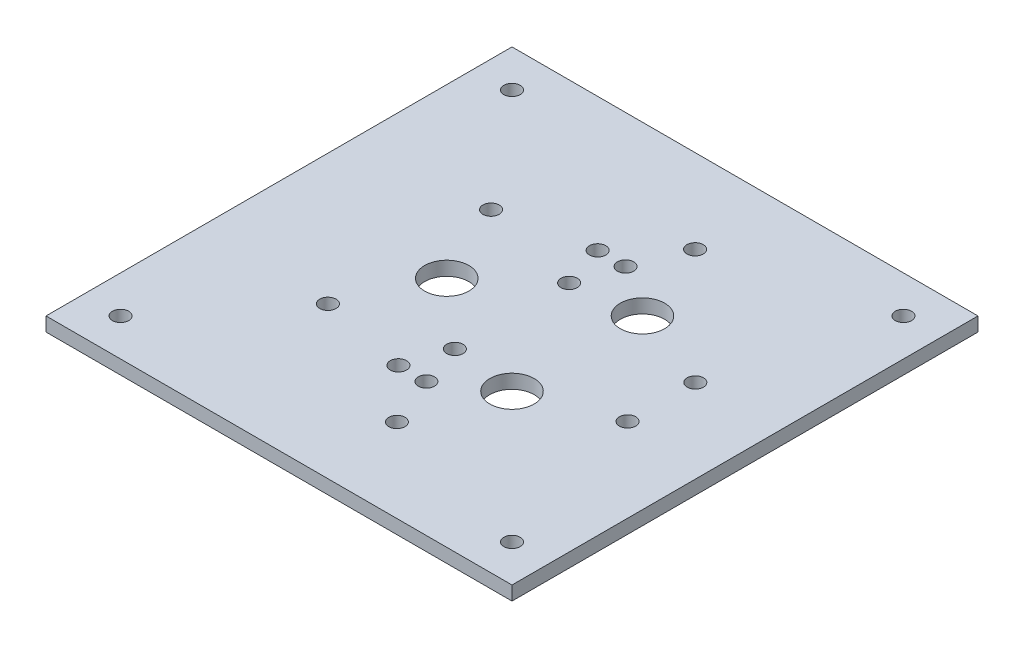
from build123d import *

# Parameters (mm, degrees)
SKETCH_2_W          = 100
SKETCH_2_H          = 100
EXTRUDE_1_DEPTH     = 3
SKETCH_3_R          = 1.75
CUT_EXTRUDE_1_DEPTH = 97.093704268
SKETCH_8_R          = 4.75
CUT_EXTRUDE_3_DEPTH = 97.093704268
SKETCH_9_R          = 1.75
CUT_EXTRUDE_4_DEPTH = 97.093704268
SKETCH_10_R         = 1.75
CUT_EXTRUDE_5_DEPTH = 10


with BuildPart() as part:
    # 草图2 → 凸台-拉伸1 (new body)
    with BuildSketch(Plane(origin=(0, 0, 0), x_dir=(1, 0, 0), z_dir=(0, 1, 0))):
        with Locations((10, 25)):
            Rectangle(SKETCH_2_W, SKETCH_2_H)
    extrude(amount=EXTRUDE_1_DEPTH)

    # 草图3 → 切除-拉伸1 (cut, through all)
    with BuildSketch(Plane(origin=(0, 3, 0), x_dir=(1, 0, 0), z_dir=(0, 1, 0))):
        with Locations((13, 3.627483327)):
            Circle(SKETCH_3_R)
        with Locations((7, 3.627483327)):
            Circle(SKETCH_3_R)
        with Locations((10, 12.735486929)):
            Circle(SKETCH_3_R)
        with Locations((13, 46.372516673)):
            Circle(SKETCH_3_R)
        with Locations((7, 46.372516673)):
            Circle(SKETCH_3_R)
        with Locations((10, 37.264513071)):
            Circle(SKETCH_3_R)
    extrude(amount=-CUT_EXTRUDE_1_DEPTH, mode=Mode.SUBTRACT)

    # 草图8 → 切除-拉伸3 (cut, through all)
    with BuildSketch(Plane.XZ):
        with Locations((-4, -25)):
            Circle(SKETCH_8_R)
        with Locations((24, -11)):
            Circle(SKETCH_8_R)
        with Locations((24, -39)):
            Circle(SKETCH_8_R)
    extrude(amount=-CUT_EXTRUDE_3_DEPTH, mode=Mode.SUBTRACT)

    # 草图9 → 切除-拉伸4 (cut, through all)
    with BuildSketch(Plane(origin=(0, 0, 0), x_dir=(-1, 0, 0), z_dir=(0, -1, 0))):
        with Locations((12, 7.5)):
            Circle(SKETCH_9_R)
        with Locations((-42.003154814, 17.792379315)):
            Circle(SKETCH_9_R)
        with Locations((-42.037642578, 32.299742527)):
            Circle(SKETCH_9_R)
        with Locations((12, 42.5)):
            Circle(SKETCH_9_R)
        with Locations((-17.265234782, 57.024786752)):
            Circle(SKETCH_9_R)
        with Locations((-17.357466454, -7.058979708)):
            Circle(SKETCH_9_R)
    extrude(amount=-CUT_EXTRUDE_4_DEPTH, mode=Mode.SUBTRACT)

    # 草图10 → 切除-拉伸5 (cut)
    with BuildSketch(Plane(origin=(0, 0, 0), x_dir=(-1, 0, 0), z_dir=(0, -1, 0))):
        with Locations((32, -17)):
            Circle(SKETCH_10_R)
        with Locations((32, 67)):
            Circle(SKETCH_10_R)
        with Locations((-52, 67)):
            Circle(SKETCH_10_R)
        with Locations((-52, -17)):
            Circle(SKETCH_10_R)
    extrude(amount=-CUT_EXTRUDE_5_DEPTH, mode=Mode.SUBTRACT)


solid = part.part
